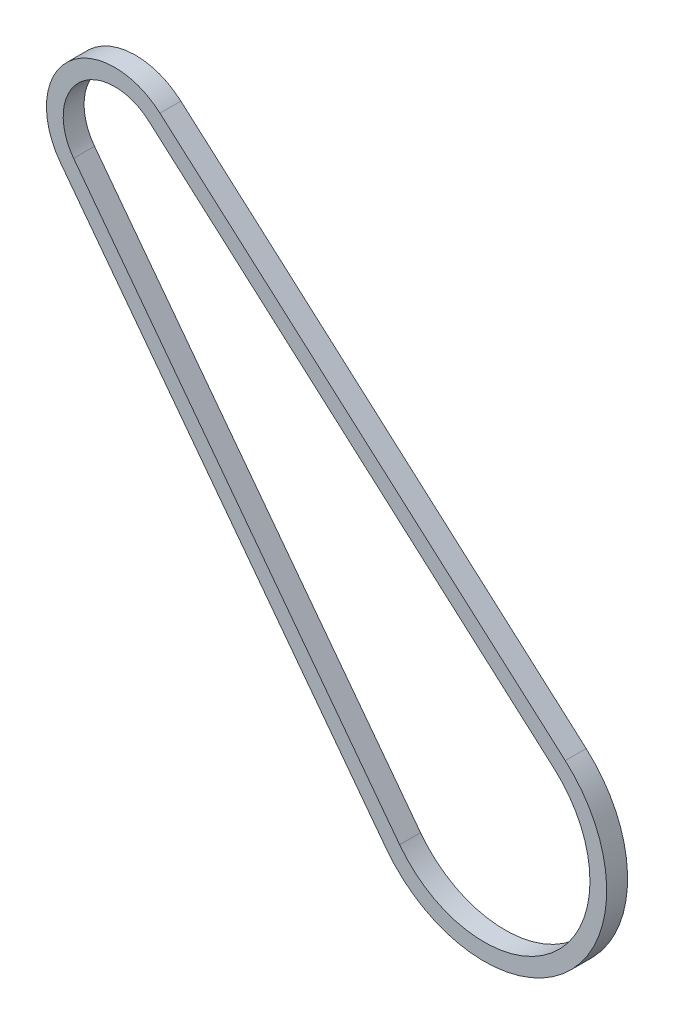
from build123d import *

# Parameters (mm, degrees)
BOSS_EXTRUDE1_DEPTH = 6.35


with BuildPart() as part:
    # Sketch1 → Boss-Extrude1 (new body)
    with BuildSketch(Plane.XY):
        with BuildLine():
            Line((-34.137583025, -18.02727577), (-133.175958564, 113.035530569))
            ThreePointArc((-133.175958564, 113.035530569), (-130.7223487, 140.76264588), (-102.88881804, 141.090816304))
            Line((-102.88881804, 141.090816304), (20.224718564, 32.329076067))
            ThreePointArc((20.224718564, 32.329076067), (20.875842163, -22.895488029), (-34.137583025, -18.02727577))
        make_face()
        with BuildLine():
            Line((-30.08461253, -14.96462493), (-129.122988069, 116.098181409))
            ThreePointArc((-129.122988069, 116.098181409), (-127.270185017, 137.035855585), (-106.252153043, 137.283668073))
            Line((-106.252153043, 137.283668073), (16.861383561, 28.521927835))
            ThreePointArc((16.861383561, 28.521927835), (17.423678479, -19.168697734), (-30.08461253, -14.96462493))
        make_face(mode=Mode.SUBTRACT)
    extrude(amount=BOSS_EXTRUDE1_DEPTH)


solid = part.part
